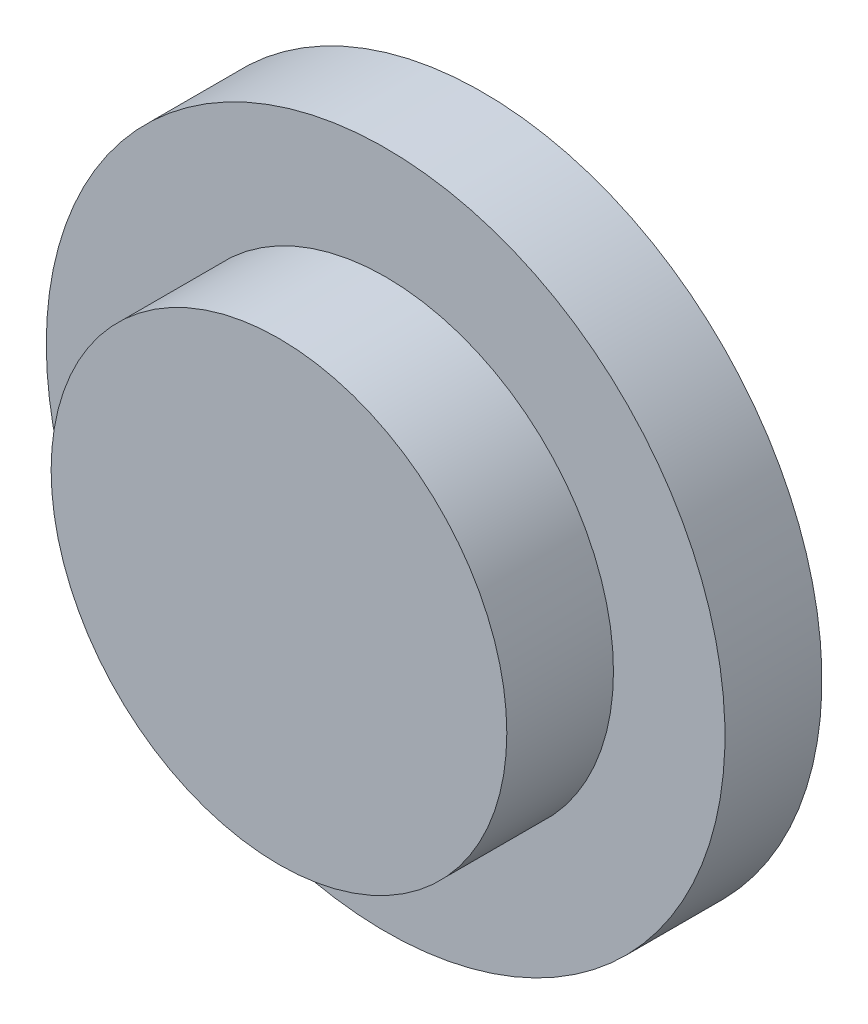
from build123d import *

# Parameters (mm, degrees)
SKETCH1_R           = 4.7
BOSS_EXTRUDE1_DEPTH = 2.2
BOSS_EXTRUDE2_DEPTH = 2
SKETCH3_R           = 7
BOSS_EXTRUDE3_DEPTH = 2
SPLIT1_START        = 2.2
SPLIT1_DEPTH        = 2


# Read off the part's stored shape, not the designer's step: Split1
with BuildPart() as part:
    # Sketch1 → Boss-Extrude1 (new body)
    with BuildSketch(Plane.XY):
        Circle(SKETCH1_R)
    extrude(amount=BOSS_EXTRUDE1_DEPTH)

    # Sketch3 → Boss-Extrude3 (add)
    with BuildSketch(Plane(origin=(0, 0, 0), x_dir=(-1, 0, 0), z_dir=(0, 0, -1))):
        Circle(SKETCH3_R)
    extrude(amount=BOSS_EXTRUDE3_DEPTH)


with BuildPart() as body_2:
    # Sketch2 → Boss-Extrude2 (new body)
    with BuildSketch(Plane.XY.offset(2.2)):
        with BuildLine():
            Line((-1.76, -11.3), (-0.76, -12.3))
            Line((-0.76, -12.3), (1, -12.3))
            Line((1, -12.3), (2, -11.3))
            Line((2, -11.3), (2, -8.490583019))
            ThreePointArc((2, -8.490583019), (2.470239954, -5.460125385), (3.836734694, -2.714676203))
            ThreePointArc((3.836734694, -2.714676203), (-0.065156188, 4.699548348), (-3.76, -2.82))
            ThreePointArc((-3.76, -2.82), (-2.273167019, -5.65772234), (-1.76, -8.82))
            Line((-1.76, -8.82), (-1.76, -11.3))
        make_face()
    extrude(amount=BOSS_EXTRUDE2_DEPTH)

    # Split1 outline → Split1 (cut)
    with BuildSketch(Plane.XY.offset(SPLIT1_START)):
        with BuildLine():
            ThreePointArc((3.836734694, -2.714676203), (-0.065156188, 4.699548348), (-3.76, -2.82))
            ThreePointArc((-3.76, -2.82), (-2.273167019, -5.65772234), (-1.76, -8.82))
            Line((-1.76, -8.82), (-1.76, -11.3))
            Line((-1.76, -11.3), (-0.76, -12.3))
            Line((-0.76, -12.3), (1, -12.3))
            Line((1, -12.3), (2, -11.3))
            Line((2, -11.3), (2, -8.490583019))
            ThreePointArc((2, -8.490583019), (2.470239954, -5.460125385), (3.836734694, -2.714676203))
        make_face()
    extrude(amount=SPLIT1_DEPTH, mode=Mode.SUBTRACT)


solid = part.part
